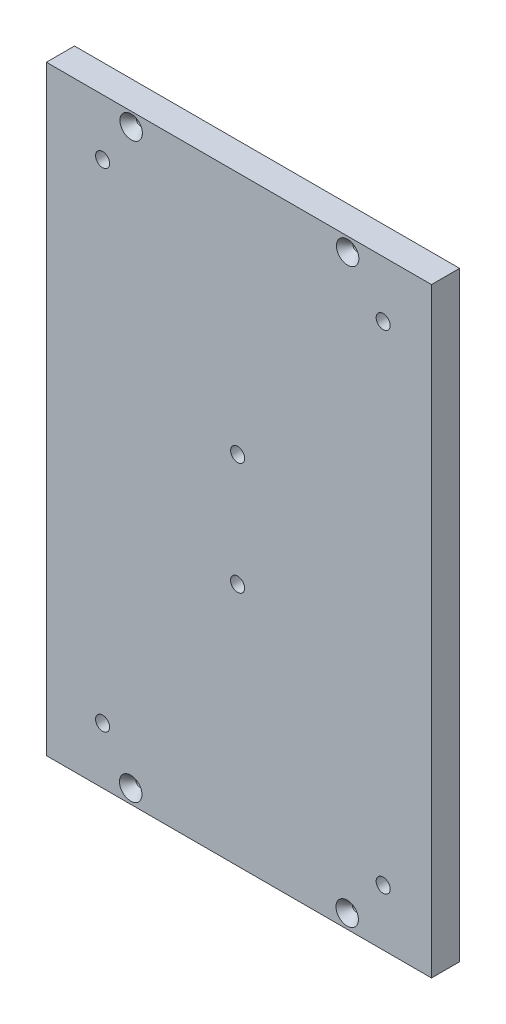
from build123d import *

# Parameters (mm, degrees)
SKETCH1_W                   = 174.021305966
SKETCH1_H                   = 271.365530146
BOSS_EXTRUDE1_DEPTH         = 12.7
F_1_4_0_25_DIAMETER_HOLE1_D = 6.35
HOLE1_D                     = 3.175
HOLE1_DEPTH                 = 31.75
HOLE1_CSINK_D               = 10.16
HOLE1_CSINK_ANGLE           = 82
HOLE1_TIP                   = 0.953866233


with BuildPart() as part:
    # Sketch1 → Boss-Extrude1 (new body)
    with BuildSketch(Plane.XY):
        with Locations((212.253144626, 135.682765073)):
            Rectangle(SKETCH1_W, SKETCH1_H)
    extrude(amount=BOSS_EXTRUDE1_DEPTH)

    # 1/4 (0.25) Diameter Hole1 (through all)
    with Locations(Plane(origin=(0, 0, 0), x_dir=(-1, 0, 0), z_dir=(0, 0, -1))):
        with Locations((-277.426568305, 245.965530146), (-211.653264176, 161.082765073), (-150.642491643, 245.965530146), (-211.653264176, 110.282765073), (-277.426568305, 25.4), (-150.642491643, 25.4)):
            Hole(F_1_4_0_25_DIAMETER_HOLE1_D / 2)

    # Hole1
    with Locations(Plane(origin=(-494.983839379, 135.816741379, 12.7), x_dir=(0, -1, 0), z_dir=(0, 0, 1))):
        with Locations((-129.257383629, 756.347108024), (129.466741379, 658.326331022), (129.466741379, 756.147636988), (-129.408220012, 658.52591835)):
            CounterSinkHole(HOLE1_D / 2, HOLE1_CSINK_D / 2, depth=HOLE1_DEPTH, counter_sink_angle=HOLE1_CSINK_ANGLE)
            with Locations((0, 0, -(HOLE1_DEPTH + HOLE1_TIP / 2))):  # 118° drill point
                Cone(0, HOLE1_D / 2, HOLE1_TIP, mode=Mode.SUBTRACT)


solid = part.part
